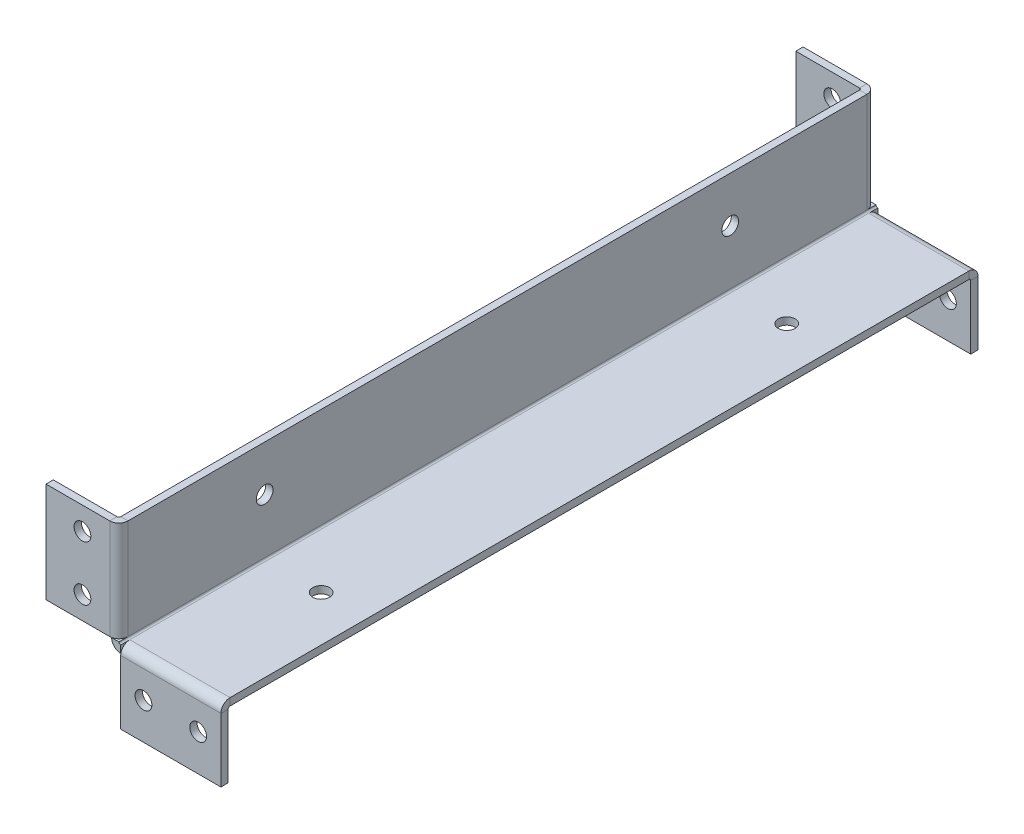
from build123d import *

# Parameters (mm, degrees)
SKETCH1_W                      = 60
SKETCH1_H                      = 415.5
BASE_FLANGE1_DEPTH             = 4
EDGE_FLANGE1_STRIP_W           = 18
EDGE_FLANGE1_STRIP_H           = 4
EDGE_FLANGE1_STRIP_CUT_DEPTH   = 415.5
EDGE_FLANGE1_DEPTH             = 415.5
EDGE_FLANGE2_STRIP_W           = 18
EDGE_FLANGE2_STRIP_H           = 4
EDGE_FLANGE2_STRIP_CUT_DEPTH   = 55
EDGE_FLANGE2_STRIP_2_W         = 18
EDGE_FLANGE2_STRIP_2_H         = 4
EDGE_FLANGE2_STRIP_CUT_2_DEPTH = 55
EDGE_FLANGE2_STRIP_3_W         = 18
EDGE_FLANGE2_STRIP_3_H         = 4
EDGE_FLANGE2_STRIP_CUT_3_DEPTH = 55
EDGE_FLANGE2_STRIP_4_W         = 18
EDGE_FLANGE2_STRIP_4_H         = 4
EDGE_FLANGE2_STRIP_CUT_4_DEPTH = 55
EDGE_FLANGE2_DEPTH             = 55
EDGE_FLANGE2_BEND_DEPTH        = 55
EDGE_FLANGE2_BEND_2_DEPTH      = 55
EDGE_FLANGE2_BEND_3_DEPTH      = 55
SKETCH18_R                     = 4.6
EXTRUDE1_DEPTH                 = 425.966175125
SKETCH19_R                     = 4.6
EXTRUDE2_DEPTH                 = 4
SKETCH20_R                     = 4.6
EXTRUDE3_DEPTH                 = 4


# Sheet-metal steps are written as plain solids
with BuildPart() as part:
    # Sketch1 → Base-Flange1 (new body)
    with BuildSketch(Plane(origin=(0, 0, 0), x_dir=(1, 0, 0), z_dir=(0, 1, 0))):
        Rectangle(SKETCH1_W, SKETCH1_H)
    extrude(amount=BASE_FLANGE1_DEPTH)

    # Edge-Flange1 strip (across the edge) → Edge-Flange1 strip cut (cut)
    with BuildSketch(Plane(origin=(-30, 4, -207.75), x_dir=(1, 0, 0), z_dir=(0, 0, 1))):
        with Locations((-4, -2)):
            Rectangle(EDGE_FLANGE1_STRIP_W, EDGE_FLANGE1_STRIP_H)
    extrude(amount=EDGE_FLANGE1_STRIP_CUT_DEPTH, mode=Mode.SUBTRACT)

    # Edge-Flange1 section (across the edge) → Edge-Flange1 (add)
    with BuildSketch(Plane(origin=(-30, 4, -207.75), x_dir=(1, 0, 0), z_dir=(0, 0, 1))):
        with BuildLine():
            Line((0, 1), (0, 56))
            Line((0, 56), (4, 56))
            Line((4, 56), (4, 1))
            ThreePointArc((4, 1), (4.292893219, 0.292893219), (5, 0))
            Line((5, 0), (5, -4))
            ThreePointArc((5, -4), (1.464466094, -2.535533906), (0, 1))
        make_face()
    extrude(amount=EDGE_FLANGE1_DEPTH)

    # Edge-Flange2 strip (across the edge) → Edge-Flange2 strip cut (cut)
    with BuildSketch(Plane(origin=(-30, 5, 207.75), x_dir=(0, 0, -1), z_dir=(0, 1, 0))):
        with Locations((-4, -2)):
            Rectangle(EDGE_FLANGE2_STRIP_W, EDGE_FLANGE2_STRIP_H)
    extrude(amount=EDGE_FLANGE2_STRIP_CUT_DEPTH, mode=Mode.SUBTRACT)

    # Edge-Flange2 strip 2 (across the edge) → Edge-Flange2 strip cut 2 (cut)
    with BuildSketch(Plane(origin=(30, 0, 207.75), x_dir=(0, 0, -1), z_dir=(-1, 0, 0))):
        with Locations((-4, -2)):
            Rectangle(EDGE_FLANGE2_STRIP_2_W, EDGE_FLANGE2_STRIP_2_H)
    extrude(amount=EDGE_FLANGE2_STRIP_CUT_2_DEPTH, mode=Mode.SUBTRACT)

    # Edge-Flange2 strip 3 (across the edge) → Edge-Flange2 strip cut 3 (cut)
    with BuildSketch(Plane(origin=(-30, 60, -207.75), x_dir=(0, 0, 1), z_dir=(0, -1, 0))):
        with Locations((-4, -2)):
            Rectangle(EDGE_FLANGE2_STRIP_3_W, EDGE_FLANGE2_STRIP_3_H)
    extrude(amount=EDGE_FLANGE2_STRIP_CUT_3_DEPTH, mode=Mode.SUBTRACT)

    # Edge-Flange2 strip 4 (across the edge) → Edge-Flange2 strip cut 4 (cut)
    with BuildSketch(Plane(origin=(-25, 0, -207.75), x_dir=(0, 0, 1), z_dir=(1, 0, 0))):
        with Locations((-4, -2)):
            Rectangle(EDGE_FLANGE2_STRIP_4_W, EDGE_FLANGE2_STRIP_4_H)
    extrude(amount=EDGE_FLANGE2_STRIP_CUT_4_DEPTH, mode=Mode.SUBTRACT)

    # Edge-Flange2 section (across the edge) → Edge-Flange2 (add)
    with BuildSketch(Plane(origin=(-30, 5, 207.75), x_dir=(0, 0, -1), z_dir=(0, 1, 0))):
        with BuildLine():
            Line((0, 1), (0, 36))
            Line((0, 36), (4, 36))
            Line((4, 36), (4, 1))
            ThreePointArc((4, 1), (4.292893219, 0.292893219), (5, 0))
            Line((5, 0), (5, -4))
            ThreePointArc((5, -4), (1.464466094, -2.535533906), (0, 1))
        make_face()
    extrude(amount=EDGE_FLANGE2_DEPTH)

    # Edge-Flange2 section 2 (across the edge) → Edge-Flange2 bend (add)
    with BuildSketch(Plane(origin=(30, 0, 207.75), x_dir=(0, 0, -1), z_dir=(-1, 0, 0))):
        with BuildLine():
            Line((0, 1), (0, 36))
            Line((0, 36), (4, 36))
            Line((4, 36), (4, 1))
            ThreePointArc((4, 1), (4.292893219, 0.292893219), (5, 0))
            Line((5, 0), (5, -4))
            ThreePointArc((5, -4), (1.464466094, -2.535533906), (0, 1))
        make_face()
    extrude(amount=EDGE_FLANGE2_BEND_DEPTH)

    # Edge-Flange2 section 3 (across the edge) → Edge-Flange2 bend 2 (add)
    with BuildSketch(Plane(origin=(-30, 60, -207.75), x_dir=(0, 0, 1), z_dir=(0, -1, 0))):
        with BuildLine():
            Line((0, 1), (0, 36))
            Line((0, 36), (4, 36))
            Line((4, 36), (4, 1))
            ThreePointArc((4, 1), (4.292893219, 0.292893219), (5, 0))
            Line((5, 0), (5, -4))
            ThreePointArc((5, -4), (1.464466094, -2.535533906), (0, 1))
        make_face()
    extrude(amount=EDGE_FLANGE2_BEND_2_DEPTH)

    # Edge-Flange2 section 4 (across the edge) → Edge-Flange2 bend 3 (add)
    with BuildSketch(Plane(origin=(-25, 0, -207.75), x_dir=(0, 0, 1), z_dir=(1, 0, 0))):
        with BuildLine():
            Line((0, 1), (0, 36))
            Line((0, 36), (4, 36))
            Line((4, 36), (4, 1))
            ThreePointArc((4, 1), (4.292893219, 0.292893219), (5, 0))
            Line((5, 0), (5, -4))
            ThreePointArc((5, -4), (1.464466094, -2.535533906), (0, 1))
        make_face()
    extrude(amount=EDGE_FLANGE2_BEND_3_DEPTH)

    # Sketch18 → Extrude1 (cut, through all)
    with BuildSketch(Plane.XY.offset(207.75)):
        with Locations((-46, 47.5)):
            Circle(SKETCH18_R)
        with Locations((-46, 17.5)):
            Circle(SKETCH18_R)
        with Locations((-12.5, -16)):
            Circle(SKETCH18_R)
        with Locations((17.5, -16)):
            Circle(SKETCH18_R)
    extrude(amount=-EXTRUDE1_DEPTH, mode=Mode.SUBTRACT)

    # Sketch19 → Extrude2 (cut)
    with BuildSketch(Plane(origin=(-26, 0, 0), x_dir=(0, 0, -1), z_dir=(1, 0, 0))):
        with Locations(Location((-127.75, 35, 0), (0, 0, 90))):
            Circle(SKETCH19_R)
        with Locations(Location((127.75, 35, 0), (0, 0, 90))):
            Circle(SKETCH19_R)
    extrude(amount=-EXTRUDE2_DEPTH, mode=Mode.SUBTRACT)

    # Sketch20 → Extrude3 (cut)
    with BuildSketch(Plane(origin=(0, 4, 0), x_dir=(1, 0, 0), z_dir=(0, 1, 0))):
        with Locations(Location((5, 127.75, 0), (0, 0, 270))):
            Circle(SKETCH20_R)
        with Locations(Location((5, -127.75, 0), (0, 0, 270))):
            Circle(SKETCH20_R)
    extrude(amount=-EXTRUDE3_DEPTH, mode=Mode.SUBTRACT)


solid = part.part
